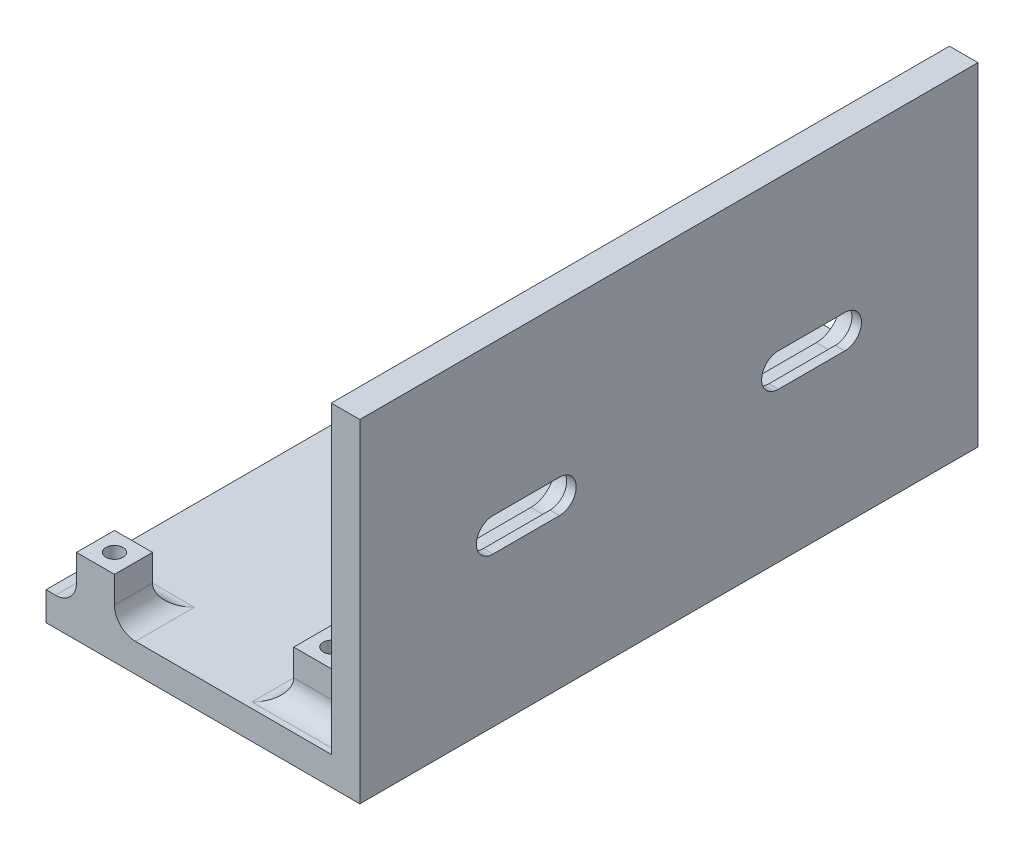
from build123d import *

# Parameters (mm, degrees)
BOSS_EXTRUDE1_DEPTH = 65
SKETCH2_R           = 0.9
SKETCH2_W           = 4
SKETCH2_H           = 4
BOSS_EXTRUDE2_DEPTH = 5
CUT_EXTRUDE2_REACH  = 81.612
CUT_EXTRUDE3_REACH  = 82.864
CUT_EXTRUDE4_DEPTH  = 2
FILLET1_R           = 2.2


with BuildPart() as part:
    # Sketch1 → Boss-Extrude1 (new body)
    with BuildSketch(Plane.XY):
        Polygon((0, 0), (33, 0), (33, 35), (30, 35), (30, 3), (0, 3), align=None)
    extrude(amount=BOSS_EXTRUDE1_DEPTH)

    # Sketch2 → Boss-Extrude2 (add)
    # profile 1 of 4: a face of its own
    with BuildSketch(Plane(origin=(0, 3, 0), x_dir=(1, 0, 0), z_dir=(0, 1, 0))):
        Polygon((8, -7.1), (8, -5.1), (8, -3.1), (4, -3.1), (4, -7.1), align=None)
        with Locations((6, -5.1)):
            Circle(SKETCH2_R, mode=Mode.SUBTRACT)
    # profile 2 of 4: a face of its own
    with BuildSketch(Plane(origin=(0, 3, 0), x_dir=(1, 0, 0), z_dir=(0, 1, 0))):
        Polygon((23.25, -58.2), (23.25, -60.2), (23.25, -62.2), (27.25, -62.2), (27.25, -58.2), align=None)
        with Locations((25.25, -60.2)):
            Circle(SKETCH2_R, mode=Mode.SUBTRACT)
    # profile 3 of 4: a face of its own
    with BuildSketch(Plane(origin=(0, 3, 0), x_dir=(1, 0, 0), z_dir=(0, 1, 0))):
        with Locations((25.25, -4.8)):
            Rectangle(SKETCH2_W, SKETCH2_H)
        with Locations((25.25, -4.8)):
            Circle(SKETCH2_R, mode=Mode.SUBTRACT)
    # profile 4 of 4: a face of its own
    with BuildSketch(Plane(origin=(0, 3, 0), x_dir=(1, 0, 0), z_dir=(0, 1, 0))):
        Polygon((7.2, -65), (7.2, -63), (7.2, -61), (3.2, -61), (3.2, -65), align=None)
        with Locations((5.2, -63)):
            Circle(SKETCH2_R, mode=Mode.SUBTRACT)
    extrude(amount=BOSS_EXTRUDE2_DEPTH)

    # Sketch3 → Cut-Extrude2 (cut, up to next)
    with BuildSketch(Plane(origin=(0, 3, 0), x_dir=(1, 0, 0), z_dir=(0, 1, 0)), mode=Mode.PRIVATE) as cut_extrude2_sk1:
        Polygon((15, -22.872736475), (30, -22.872736475), (30, -12.372736475), (13.5, -12.372736475), (13.5, -22.872736475), align=None)
    cut_extrude2_tool1 = extrude(cut_extrude2_sk1.sketch, amount=-CUT_EXTRUDE2_REACH, mode=Mode.PRIVATE) & part.part
    add(cut_extrude2_tool1.solids().sort_by_distance((21.75, 3, 17.622736))[0], mode=Mode.SUBTRACT)

    # Sketch4 → Cut-Extrude3 (cut, up to next)
    with BuildSketch(Plane(origin=(33, 0, 0), x_dir=(0, 0, -1), z_dir=(1, 0, 0)), mode=Mode.PRIVATE) as cut_extrude3_sk1:
        with BuildLine():
            Line((-50.99811037, 15.75), (-44.00188963, 15.75))
            ThreePointArc((-44.00188963, 15.75), (-42.764452763, 16.262563133), (-42.25188963, 17.5))
            ThreePointArc((-42.25188963, 17.5), (-42.764452763, 18.737436867), (-44.00188963, 19.25))
            Line((-44.00188963, 19.25), (-50.99811037, 19.25))
            ThreePointArc((-50.99811037, 19.25), (-52.74811037, 17.5), (-50.99811037, 15.75))
        make_face()
    cut_extrude3_tool1 = extrude(cut_extrude3_sk1.sketch, amount=-CUT_EXTRUDE3_REACH, mode=Mode.PRIVATE) & part.part
    # Sketch4 → Cut-Extrude3 (cut, up to next)
    with BuildSketch(Plane(origin=(33, 0, 0), x_dir=(0, 0, -1), z_dir=(1, 0, 0)), mode=Mode.PRIVATE) as cut_extrude3_sk2:
        with BuildLine():
            ThreePointArc((-20.99811037, 19.25), (-22.74811037, 17.5), (-20.99811037, 15.75))
            Line((-20.99811037, 15.75), (-14.00188963, 15.75))
            ThreePointArc((-14.00188963, 15.75), (-12.25188963, 17.5), (-14.00188963, 19.25))
            Line((-14.00188963, 19.25), (-20.99811037, 19.25))
        make_face()
    cut_extrude3_tool2 = extrude(cut_extrude3_sk2.sketch, amount=-CUT_EXTRUDE3_REACH, mode=Mode.PRIVATE) & part.part
    add(cut_extrude3_tool1.solids().sort_by_distance((33, 17.5, 47.5))[0], mode=Mode.SUBTRACT)
    add(cut_extrude3_tool2.solids().sort_by_distance((33, 17.5, 17.5))[0], mode=Mode.SUBTRACT)

    # Sketch5 → Cut-Extrude4 (cut)
    with BuildSketch(Plane.ZY.offset(-30)):
        with BuildLine():
            Line((20.99811037, 15), (14.00188963, 15))
            ThreePointArc((14.00188963, 15), (11.50188963, 17.5), (14.00188963, 20))
            Line((14.00188963, 20), (20.99811037, 20))
            ThreePointArc((20.99811037, 20), (23.49811037, 17.5), (20.99811037, 15))
        make_face()
        with BuildLine():
            Line((44.00188963, 20), (50.99811037, 20))
            ThreePointArc((50.99811037, 20), (53.49811037, 17.5), (50.99811037, 15))
            Line((50.99811037, 15), (44.00188963, 15))
            ThreePointArc((44.00188963, 15), (41.50188963, 17.5), (44.00188963, 20))
        make_face()
    extrude(amount=-CUT_EXTRUDE4_DEPTH, mode=Mode.SUBTRACT)

    # Fillet1
    fillet1_edges = [part.edges().sort_by_distance(p)[0] for p in [
        (27.25, 3, 60.2),
        (25.25, 3, 62.2),
        (25.25, 3, 58.2),
        (23.25, 3, 60.2),
        (7.2, 3, 63),
        (5.2, 3, 61),
        (3.2, 3, 63),
        (27.25, 3, 4.8),
        (25.25, 3, 6.8),
        (25.25, 3, 2.8),
        (23.25, 3, 4.8),
        (8, 3, 5.1),
        (6, 3, 7.1),
        (6, 3, 3.1),
        (4, 3, 5.1),
    ]]
    fillet(fillet1_edges, radius=FILLET1_R)


solid = part.part
